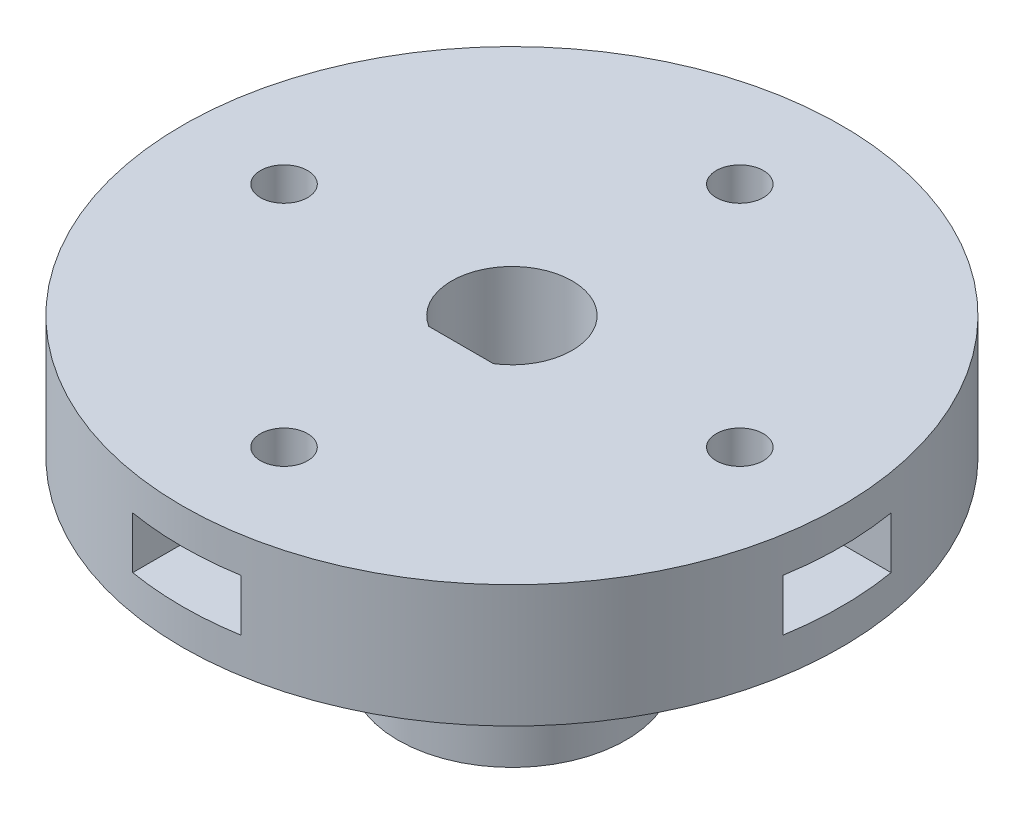
from build123d import *

# Parameters (mm, degrees)
SKETCH1_R                      = 6.05
SKETCH1_R_2                    = 3.05
BOSS_EXTRUDE1_DEPTH            = 10
SKETCH2_R                      = 17.5
BOSS_EXTRUDE2_DEPTH            = 6.5
CUT_EXTRUDE1_REACH             = 28.693
SKETCH3_R                      = 1.25
CUT_EXTRUDE2_DEPTH             = 30.744747435
CUT_EXTRUDE2_DEPTH_BACK        = 30.744747435
SKETCH4_R                      = 1.5
CUT_EXTRUDE3_REACH             = 28.693
SKETCH6_R                      = 3.2
CUT_EXTRUDE3_DIRECTION_2_REACH = 28.693
BOSS_EXTRUDE3_DEPTH            = 16.5
SKETCH8_W                      = 5.75
SKETCH8_H                      = 2.75
CUT_EXTRUDE4_DEPTH             = 5
CUT_EXTRUDE5_DEPTH             = 2.75
CIRPATTERN1_START              = 11.875
CIRPATTERN1_OUTLINE_R          = 1.25
CIRPATTERN1_DEPTH              = 2.75


# Read off the part's stored shape, not the designer's step: CirPattern1
with BuildPart() as part:
    # Sketch1 → Boss-Extrude1 (new body)
    with BuildSketch(Plane(origin=(0, 0, 0), x_dir=(1, 0, 0), z_dir=(0, 1, 0))):
        with Locations(Location((0, 0, 0), (0, 0, 270))):
            Circle(SKETCH1_R)
        with Locations(Location((0, 0, 0), (0, 0, 270))):
            Circle(SKETCH1_R_2, mode=Mode.SUBTRACT)
    extrude(amount=BOSS_EXTRUDE1_DEPTH)

    # Sketch2 → Boss-Extrude2 (add)
    with BuildSketch(Plane(origin=(0, 10, 0), x_dir=(1, 0, 0), z_dir=(0, 1, 0))):
        with Locations(Location((0, 0, 0), (0, 0, 90))):
            Circle(SKETCH2_R)
    extrude(amount=BOSS_EXTRUDE2_DEPTH)

    # Sketch3 → Cut-Extrude1 (cut, up to next)
    with BuildSketch(Plane.XZ.offset(-10), mode=Mode.PRIVATE) as cut_extrude1_sk1:
        with Locations(Location((12.1, 0, 0), (0, 0, 270))):
            Circle(SKETCH3_R)
    cut_extrude1_tool1 = extrude(cut_extrude1_sk1.sketch, amount=-CUT_EXTRUDE1_REACH, mode=Mode.PRIVATE) & part.part
    # Sketch3 → Cut-Extrude1 (cut, up to next)
    with BuildSketch(Plane.XZ.offset(-10), mode=Mode.PRIVATE) as cut_extrude1_sk2:
        with Locations(Location((0, -12.1, 0), (0, 0, 270))):
            Circle(SKETCH3_R)
    cut_extrude1_tool2 = extrude(cut_extrude1_sk2.sketch, amount=-CUT_EXTRUDE1_REACH, mode=Mode.PRIVATE) & part.part
    # Sketch3 → Cut-Extrude1 (cut, up to next)
    with BuildSketch(Plane.XZ.offset(-10), mode=Mode.PRIVATE) as cut_extrude1_sk3:
        with Locations(Location((-12.1, 0, 0), (0, 0, 270))):
            Circle(SKETCH3_R)
    cut_extrude1_tool3 = extrude(cut_extrude1_sk3.sketch, amount=-CUT_EXTRUDE1_REACH, mode=Mode.PRIVATE) & part.part
    # Sketch3 → Cut-Extrude1 (cut, up to next)
    with BuildSketch(Plane.XZ.offset(-10), mode=Mode.PRIVATE) as cut_extrude1_sk4:
        with Locations(Location((0, 12.1, 0), (0, 0, 270))):
            Circle(SKETCH3_R)
    cut_extrude1_tool4 = extrude(cut_extrude1_sk4.sketch, amount=-CUT_EXTRUDE1_REACH, mode=Mode.PRIVATE) & part.part
    add(cut_extrude1_tool1.solids().sort_by_distance((12.1, 10, 0))[0], mode=Mode.SUBTRACT)
    add(cut_extrude1_tool2.solids().sort_by_distance((0, 10, -12.1))[0], mode=Mode.SUBTRACT)
    add(cut_extrude1_tool3.solids().sort_by_distance((-12.1, 10, 0))[0], mode=Mode.SUBTRACT)
    add(cut_extrude1_tool4.solids().sort_by_distance((0, 10, 12.1))[0], mode=Mode.SUBTRACT)

    # Sketch4 → Cut-Extrude2 (cut, two sides: drawn at the far end of the back side and taken through both)
    with BuildSketch(Plane.XY.offset(-CUT_EXTRUDE2_DEPTH_BACK)):
        with Locations((0, 4.916404418)):
            Circle(SKETCH4_R)
    extrude(amount=CUT_EXTRUDE2_DEPTH + CUT_EXTRUDE2_DEPTH_BACK, mode=Mode.SUBTRACT)

    # Sketch6 → Cut-Extrude3 (cut, up to next)
    with BuildSketch(Plane(origin=(0, 10, 0), x_dir=(-1, 0, 0), z_dir=(0, -1, 0)), mode=Mode.PRIVATE) as cut_extrude3_sk1:
        with Locations(Location((0, 0, 0), (0, 0, 270))):
            Circle(SKETCH6_R)
    cut_extrude3_tool1 = extrude(cut_extrude3_sk1.sketch, amount=-CUT_EXTRUDE3_REACH, mode=Mode.PRIVATE) & part.part
    add(cut_extrude3_tool1.solids().sort_by_distance((0, 10, 0))[0], mode=Mode.SUBTRACT)

    # Sketch6 → Cut-Extrude3 direction 2 (cut, up to next)
    with BuildSketch(Plane(origin=(0, 10, 0), x_dir=(-1, 0, 0), z_dir=(0, -1, 0)), mode=Mode.PRIVATE) as cut_extrude3_direction_2_sk1:
        with Locations(Location((0, 0, 0), (0, 0, 270))):
            Circle(SKETCH6_R)
    cut_extrude3_direction_2_tool1 = extrude(cut_extrude3_direction_2_sk1.sketch, amount=CUT_EXTRUDE3_DIRECTION_2_REACH, mode=Mode.PRIVATE) & part.part
    add(cut_extrude3_direction_2_tool1.solids().sort_by_distance((0, 10, 0))[0], mode=Mode.SUBTRACT)

    # Sketch7 → Boss-Extrude3 (add)
    with BuildSketch(Plane.XZ):
        with BuildLine():
            Line((-1.717556404, 2.7), (1.717556404, 2.7))
            ThreePointArc((1.717556404, 2.7), (0, 3.2), (-1.717556404, 2.7))
        make_face()
    extrude(amount=-BOSS_EXTRUDE3_DEPTH)

    # Sketch8 → Cut-Extrude4 (cut)
    with BuildSketch(Plane(origin=(17.5, 0, 0), x_dir=(0, 0, -1), z_dir=(1, 0, 0))):
        with Locations((0, 13.25)):
            Rectangle(SKETCH8_W, SKETCH8_H)
    extrude(amount=-CUT_EXTRUDE4_DEPTH, mode=Mode.SUBTRACT)

    # Sketch9 → Cut-Extrude5 (cut)
    with BuildSketch(Plane.XZ.offset(-14.625)):
        Polygon((15.419764048, 0), (13.759882024, 2.875), (10.440117976, 2.875), (8.780235952, 0), (10.440117976, -2.875), (13.759882024, -2.875), align=None)
    extrude(amount=CUT_EXTRUDE5_DEPTH, mode=Mode.SUBTRACT)

    # CirPattern1 outline → CirPattern1 (cut)
    # profile 1 of 3: a face of its own
    with BuildSketch(Plane(origin=(0, 0, 0), x_dir=(1, 0, 0), z_dir=(0, 1, 0)).offset(CIRPATTERN1_START)):
        with BuildLine():
            Line((-8.780235952, 0), (-10.440117976, 2.875))
            Line((-10.440117976, 2.875), (-17.26222393, 2.875))
            ThreePointArc((-17.26222393, 2.875), (-17.5, 0), (-17.26222393, -2.875))
            Line((-17.26222393, -2.875), (-10.440117976, -2.875))
            Line((-10.440117976, -2.875), (-8.780235952, 0))
        make_face()
        with Locations((-12.1, 0)):
            Circle(CIRPATTERN1_OUTLINE_R, mode=Mode.SUBTRACT)
    # profile 2 of 3: a face of its own
    with BuildSketch(Plane(origin=(0, 0, 0), x_dir=(1, 0, 0), z_dir=(0, 1, 0)).offset(CIRPATTERN1_START)):
        with BuildLine():
            ThreePointArc((2.875, 17.26222393), (0, 17.5), (-2.875, 17.26222393))
            Line((-2.875, 17.26222393), (-2.875, 10.440117976))
            Line((-2.875, 10.440117976), (0, 8.780235952))
            Line((0, 8.780235952), (2.875, 10.440117976))
            Line((2.875, 10.440117976), (2.875, 17.26222393))
        make_face()
        with Locations((0, 12.1)):
            Circle(CIRPATTERN1_OUTLINE_R, mode=Mode.SUBTRACT)
    # profile 3 of 3: a face of its own
    with BuildSketch(Plane(origin=(0, 0, 0), x_dir=(1, 0, 0), z_dir=(0, 1, 0)).offset(CIRPATTERN1_START)):
        with BuildLine():
            Line((-2.875, -10.440117976), (-2.875, -17.26222393))
            ThreePointArc((-2.875, -17.26222393), (0, -17.5), (2.875, -17.26222393))
            Line((2.875, -17.26222393), (2.875, -10.440117976))
            Line((2.875, -10.440117976), (0, -8.780235952))
            Line((0, -8.780235952), (-2.875, -10.440117976))
        make_face()
        with Locations((0, -12.1)):
            Circle(CIRPATTERN1_OUTLINE_R, mode=Mode.SUBTRACT)
    extrude(amount=CIRPATTERN1_DEPTH, mode=Mode.SUBTRACT)


solid = part.part
